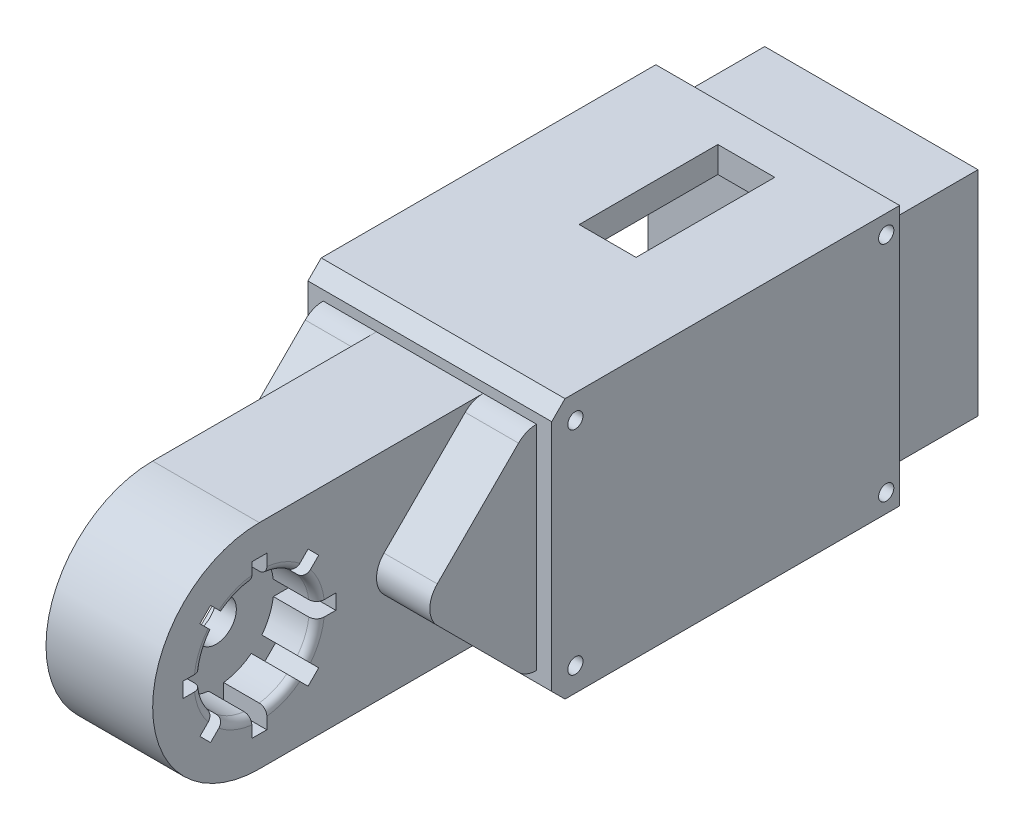
from build123d import *

# Parameters (mm, degrees)
SKETCH2_W                = 42
SKETCH2_H                = 42
BOSS_EXTRUDE1_DEPTH      = 89
SKETCH3_W                = 21
SKETCH3_H                = 42
BOSS_EXTRUDE2_DEPTH      = 42
BOSS_EXTRUDE3_DEPTH      = 21
SKETCH9_R                = 11.35
CUT_EXTRUDE2_DEPTH       = 8.5
CUT_EXTRUDE3_START       = -8.5
SKETCH11_R               = 11.35
CUT_EXTRUDE3_DEPTH       = 8.5
SKETCH12_R               = 3.975
CUT_EXTRUDE4_DEPTH       = 156.157984003
BOSS_EXTRUDE4_DEPTH      = 10.5
BOSS_EXTRUDE4_DEPTH_BACK = 31.5
FILLET1_R                = 5
FILLET2_R                = 5
FILLET3_R                = 5
FILLET4_R                = 5
FILLET5_R                = 5
FILLET6_R                = 5
FILLET7_R                = 1.5
FILLET8_R                = 1.5
SKETCH21_W               = 2.95860585
SKETCH21_H               = 4.417
CUT_EXTRUDE5_DEPTH       = 8.5
CIRPATTERN2_COUNT        = 8
MIRROR1_COPY_1_SKETCH_W  = 2.95860585
MIRROR1_COPY_1_SKETCH_H  = 4.417
MIRROR1_COPY_1_DEPTH     = 8.5
MIRROR1_COPY_2_SKETCH_W  = 2.95860585
MIRROR1_COPY_2_SKETCH_H  = 4.417
MIRROR1_COPY_2_DEPTH     = 8.5
MIRROR1_COPY_3_SKETCH_W  = 2.95860585
MIRROR1_COPY_3_SKETCH_H  = 4.417
MIRROR1_COPY_3_DEPTH     = 8.5
MIRROR1_COPY_4_SKETCH_W  = 2.95860585
MIRROR1_COPY_4_SKETCH_H  = 4.417
MIRROR1_COPY_4_DEPTH     = 8.5
MIRROR1_COPY_5_SKETCH_W  = 2.95860585
MIRROR1_COPY_5_SKETCH_H  = 4.417
MIRROR1_COPY_5_DEPTH     = 8.5
MIRROR1_COPY_6_SKETCH_W  = 2.95860585
MIRROR1_COPY_6_SKETCH_H  = 4.417
MIRROR1_COPY_6_DEPTH     = 8.5
MIRROR1_COPY_7_SKETCH_W  = 2.95860585
MIRROR1_COPY_7_SKETCH_H  = 4.417
MIRROR1_COPY_7_DEPTH     = 8.5
MIRROR1_COPY_8_SKETCH_W  = 2.95860585
MIRROR1_COPY_8_SKETCH_H  = 4.417
MIRROR1_COPY_8_DEPTH     = 8.5
SKETCH24_W               = 86.928932188
SKETCH24_H               = 4.545220174
SKETCH24_H_2             = 4.689106432
BOSS_EXTRUDE6_DEPTH      = 42
SKETCH25_W               = 68.5
SKETCH25_H               = 51.234326606
BOSS_EXTRUDE7_DEPTH      = 3
SKETCH28_W               = 68.5
SKETCH28_H               = 51.234326606
BOSS_EXTRUDE8_DEPTH      = 3
SKETCH30_W               = 62
SKETCH30_H               = 41.004326606
CUT_EXTRUDE6_DEPTH       = 45
SKETCH31_W               = 18.428932188
SKETCH31_H               = 4.615
CUT_EXTRUDE7_DEPTH       = 161.589321529
CHAMFER1_SIZE            = 1.5
SKETCH32_W               = 30
SKETCH32_H               = 30
CUT_EXTRUDE8_DEPTH       = 16.8
SKETCH33_R               = 5
CUT_EXTRUDE9_DEPTH       = 16.8
CUT_EXTRUDE10_DEPTH      = 162.455660134
CHAMFER2_SIZE            = 6
CHAMFER3_SIZE            = 6
CHAMFER4_SIZE            = 6
CHAMFER5_SIZE            = 6
SKETCH35_R               = 1.5
CUT_EXTRUDE11_DEPTH      = 162.455660134
SKETCH38_W               = 11.2
SKETCH38_H               = 27.3
CUT_EXTRUDE12_DEPTH      = 163.188027372


with BuildPart() as part:
    # Sketch2 → Boss-Extrude1 (new body)
    with BuildSketch(Plane.XY):
        Rectangle(SKETCH2_W, SKETCH2_H)
    extrude(amount=BOSS_EXTRUDE1_DEPTH)

    # Sketch3 → Boss-Extrude2 (add)
    with BuildSketch(Plane.XY.offset(89)):
        Rectangle(SKETCH3_W, SKETCH3_H)
    extrude(amount=BOSS_EXTRUDE2_DEPTH)

    # Sketch8 → Boss-Extrude3 (add)
    with BuildSketch(Plane.ZY.offset(10.5)):
        with BuildLine():
            Line((131, 21), (131, -21))
            ThreePointArc((131, -21), (152, 0), (131, 21))
        make_face()
    extrude(amount=-BOSS_EXTRUDE3_DEPTH)

    # Sketch9 → Cut-Extrude2 (cut)
    with BuildSketch(Plane.ZY.offset(10.5)):
        with Locations((131, 0)):
            Circle(SKETCH9_R)
    extrude(amount=-CUT_EXTRUDE2_DEPTH, mode=Mode.SUBTRACT)

    # Sketch11 → Cut-Extrude3 (cut)
    with BuildSketch(Plane(origin=(10.5, 0, 0), x_dir=(0, 0, -1), z_dir=(1, 0, 0)).offset(CUT_EXTRUDE3_START)):
        with Locations((-131, 0)):
            Circle(SKETCH11_R)
    extrude(amount=CUT_EXTRUDE3_DEPTH, mode=Mode.SUBTRACT)

    # Sketch12 → Cut-Extrude4 (cut, through all)
    with BuildSketch(Plane.ZY.offset(2)):
        with Locations((131, 0)):
            Circle(SKETCH12_R)
    extrude(amount=-CUT_EXTRUDE4_DEPTH, mode=Mode.SUBTRACT)

    # Sketch20 → Boss-Extrude4 (add, two sides: drawn at the far end of the back side and taken through both)
    with BuildSketch(Plane.ZY.offset(10.5).offset(-BOSS_EXTRUDE4_DEPTH_BACK)):
        Polygon((89, -21), (110, 0), (89, 21), align=None)
    extrude(amount=BOSS_EXTRUDE4_DEPTH + BOSS_EXTRUDE4_DEPTH_BACK)

    # Fillet1
    fillet1_edges = [part.edges().sort_by_distance(p)[0] for p in [
        (15.75, 0, 110),
    ]]
    fillet(fillet1_edges, radius=FILLET1_R)

    # Fillet2
    fillet2_edges = [part.edges().sort_by_distance(p)[0] for p in [
        (-15.75, 0, 110),
    ]]
    fillet(fillet2_edges, radius=FILLET2_R)

    # Fillet3
    fillet3_edges = [part.edges().sort_by_distance(p)[0] for p in [
        (-15.75, -21, 89),
    ]]
    fillet(fillet3_edges, radius=FILLET3_R)

    # Fillet4
    fillet4_edges = [part.edges().sort_by_distance(p)[0] for p in [
        (-15.75, 21, 89),
    ]]
    fillet(fillet4_edges, radius=FILLET4_R)

    # Fillet5
    fillet5_edges = [part.edges().sort_by_distance(p)[0] for p in [
        (15.75, -21, 89),
    ]]
    fillet(fillet5_edges, radius=FILLET5_R)

    # Fillet6
    fillet6_edges = [part.edges().sort_by_distance(p)[0] for p in [
        (15.75, 21, 89),
    ]]
    fillet(fillet6_edges, radius=FILLET6_R)

    # Fillet7
    fillet7_edges = [part.edges().sort_by_distance(p)[0] for p in [
        (-10.5, 0, 119.65),
    ]]
    fillet(fillet7_edges, radius=FILLET7_R)

    # Fillet8
    fillet8_edges = [part.edges().sort_by_distance(p)[0] for p in [
        (10.5, 0, 142.35),
    ]]
    fillet(fillet8_edges, radius=FILLET8_R)

    # Sketch21 → Cut-Extrude5 (cut)
    with BuildSketch(Plane.ZY.offset(10.5)):
        with Locations((131, 12.85)):
            Rectangle(SKETCH21_W, SKETCH21_H)
    cut_extrude5 = extrude(amount=-CUT_EXTRUDE5_DEPTH, mode=Mode.SUBTRACT)

    # CirPattern2: Cut-Extrude5 ×8 about axis
    cirpattern2_axis = Axis((-9, 0, 131), (-1, 0, 0))
    for i in range(1, CIRPATTERN2_COUNT):
        add(cut_extrude5.rotate(cirpattern2_axis, i * 360 / CIRPATTERN2_COUNT), mode=Mode.SUBTRACT)

    # Mirror1 copy 1 sketch → Mirror1 copy 1 (cut)
    with BuildSketch(Plane(origin=(10.5, -92.630988335, 38.369011665), x_dir=(0, 0.7071067811865475, 0.7071067811865476), z_dir=(1, 0, 0))):
        with Locations((131, -12.85)):
            Rectangle(MIRROR1_COPY_1_SKETCH_W, MIRROR1_COPY_1_SKETCH_H)
    extrude(amount=-MIRROR1_COPY_1_DEPTH, mode=Mode.SUBTRACT)

    # Mirror1 copy 2 sketch → Mirror1 copy 2 (cut)
    with BuildSketch(Plane(origin=(10.5, -131, 131), x_dir=(0, 1, 0), z_dir=(1, 0, 0))):
        with Locations((131, -12.85)):
            Rectangle(MIRROR1_COPY_2_SKETCH_W, MIRROR1_COPY_2_SKETCH_H)
    extrude(amount=-MIRROR1_COPY_2_DEPTH, mode=Mode.SUBTRACT)

    # Mirror1 copy 3 sketch → Mirror1 copy 3 (cut)
    with BuildSketch(Plane(origin=(10.5, -92.630988335, 223.630988335), x_dir=(0, 0.7071067811865476, -0.7071067811865475), z_dir=(1, 0, 0))):
        with Locations((131, -12.85)):
            Rectangle(MIRROR1_COPY_3_SKETCH_W, MIRROR1_COPY_3_SKETCH_H)
    extrude(amount=-MIRROR1_COPY_3_DEPTH, mode=Mode.SUBTRACT)

    # Mirror1 copy 4 sketch → Mirror1 copy 4 (cut)
    with BuildSketch(Plane(origin=(10.5, 0, 262), x_dir=(0, 0, -1), z_dir=(1, 0, 0))):
        with Locations((131, -12.85)):
            Rectangle(MIRROR1_COPY_4_SKETCH_W, MIRROR1_COPY_4_SKETCH_H)
    extrude(amount=-MIRROR1_COPY_4_DEPTH, mode=Mode.SUBTRACT)

    # Mirror1 copy 5 sketch → Mirror1 copy 5 (cut)
    with BuildSketch(Plane(origin=(10.5, 92.630988335, 223.630988335), x_dir=(0, -0.7071067811865475, -0.7071067811865477), z_dir=(1, 0, 0))):
        with Locations((131, -12.85)):
            Rectangle(MIRROR1_COPY_5_SKETCH_W, MIRROR1_COPY_5_SKETCH_H)
    extrude(amount=-MIRROR1_COPY_5_DEPTH, mode=Mode.SUBTRACT)

    # Mirror1 copy 6 sketch → Mirror1 copy 6 (cut)
    with BuildSketch(Plane(origin=(10.5, 131, 131), x_dir=(0, -1, 0), z_dir=(1, 0, 0))):
        with Locations((131, -12.85)):
            Rectangle(MIRROR1_COPY_6_SKETCH_W, MIRROR1_COPY_6_SKETCH_H)
    extrude(amount=-MIRROR1_COPY_6_DEPTH, mode=Mode.SUBTRACT)

    # Mirror1 copy 7 sketch → Mirror1 copy 7 (cut)
    with BuildSketch(Plane(origin=(10.5, 92.630988335, 38.369011665), x_dir=(0, -0.7071067811865477, 0.7071067811865474), z_dir=(1, 0, 0))):
        with Locations((131, -12.85)):
            Rectangle(MIRROR1_COPY_7_SKETCH_W, MIRROR1_COPY_7_SKETCH_H)
    extrude(amount=-MIRROR1_COPY_7_DEPTH, mode=Mode.SUBTRACT)

    # Mirror1 copy 8 sketch → Mirror1 copy 8 (cut)
    with BuildSketch(Plane(origin=(10.5, 0, 0), x_dir=(0, 0, 1), z_dir=(1, 0, 0))):
        with Locations((131, -12.85)):
            Rectangle(MIRROR1_COPY_8_SKETCH_W, MIRROR1_COPY_8_SKETCH_H)
    extrude(amount=-MIRROR1_COPY_8_DEPTH, mode=Mode.SUBTRACT)

    # Sketch24 → Boss-Extrude6 (add)
    with BuildSketch(Plane(origin=(21, 0, 0), x_dir=(0, 0, -1), z_dir=(1, 0, 0))):
        with Locations((-43.464466094, 23.272610087)):
            Rectangle(SKETCH24_W, SKETCH24_H)
        with Locations((-43.464466094, -23.344553216)):
            Rectangle(SKETCH24_W, SKETCH24_H_2)
    extrude(amount=-BOSS_EXTRUDE6_DEPTH)

    # Sketch25 → Boss-Extrude7 (add)
    with BuildSketch(Plane(origin=(21, 0, 0), x_dir=(0, 0, -1), z_dir=(1, 0, 0))):
        with Locations((-52.678932188, -0.071943129)):
            Rectangle(SKETCH25_W, SKETCH25_H)
    extrude(amount=BOSS_EXTRUDE7_DEPTH)

    # Sketch28 → Boss-Extrude8 (add)
    with BuildSketch(Plane.ZY.offset(21)):
        with Locations((52.678932188, -0.071943129)):
            Rectangle(SKETCH28_W, SKETCH28_H)
    extrude(amount=BOSS_EXTRUDE8_DEPTH)

    # Sketch30 → Cut-Extrude6 (cut)
    with BuildSketch(Plane.ZY.offset(24)):
        with Locations((50.928932188, -0.071943129)):
            Rectangle(SKETCH30_W, SKETCH30_H)
    extrude(amount=-CUT_EXTRUDE6_DEPTH, mode=Mode.SUBTRACT)

    # Sketch31 → Cut-Extrude7 (cut, through all)
    with BuildSketch(Plane(origin=(21, 0, 0), x_dir=(0, 0, -1), z_dir=(1, 0, 0))):
        with Locations((-9.214466094, -23.381606432)):
            Rectangle(SKETCH31_W, SKETCH31_H)
        with Locations((-9.214466094, 23.237720174)):
            Rectangle(SKETCH31_W, SKETCH31_H)
    extrude(amount=-CUT_EXTRUDE7_DEPTH, mode=Mode.SUBTRACT)

    # Chamfer1
    chamfer1_edges = [part.edges().sort_by_distance(p)[0] for p in [
        (0, 20.930220174, 18.428932188),
        (21, -0.071943129, 18.428932188),
        (0, -21.074106432, 18.428932188),
        (-21, -0.071943129, 18.428932188),
    ]]
    chamfer(chamfer1_edges, length=CHAMFER1_SIZE)

    # Sketch32 → Cut-Extrude8 (cut)
    with BuildSketch(Plane(origin=(0, 0, 0), x_dir=(-1, 0, 0), z_dir=(0, 0, -1))):
        Rectangle(SKETCH32_W, SKETCH32_H)
    extrude(amount=-CUT_EXTRUDE8_DEPTH, mode=Mode.SUBTRACT)

    # Sketch33 → Cut-Extrude9 (cut)
    with BuildSketch(Plane.XY.offset(19.928932188)):
        Circle(SKETCH33_R)
    extrude(amount=-CUT_EXTRUDE9_DEPTH, mode=Mode.SUBTRACT)

    # Sketch34 → Cut-Extrude10 (cut, through all)
    with BuildSketch(Plane.ZY.offset(24)):
        Polygon((88.330412389, -21.669587611), (88.330412389, -28.222069099), (81.777930901, -28.222069099), align=None)
        Polygon((88.330412389, 28.078182842), (81.777930901, 28.078182842), (88.330412389, 21.525701354), align=None)
    extrude(amount=-CUT_EXTRUDE10_DEPTH, mode=Mode.SUBTRACT)

    # Chamfer2
    chamfer2_edges = [part.edges().sort_by_distance(p)[0] for p in [
        (-1.5, 20.430220174, 81.928932188),
    ]]
    chamfer(chamfer2_edges, length=CHAMFER2_SIZE)

    # Chamfer3
    chamfer3_edges = [part.edges().sort_by_distance(p)[0] for p in [
        (-1.5, -20.574106432, 81.928932188),
    ]]
    chamfer(chamfer3_edges, length=CHAMFER3_SIZE)

    # Chamfer4
    chamfer4_edges = [part.edges().sort_by_distance(p)[0] for p in [
        (-1.5, 20.430220174, 19.928932188),
    ]]
    chamfer(chamfer4_edges, length=CHAMFER4_SIZE)

    # Chamfer5
    chamfer5_edges = [part.edges().sort_by_distance(p)[0] for p in [
        (-1.5, -20.574106432, 19.928932188),
    ]]
    chamfer(chamfer5_edges, length=CHAMFER5_SIZE)

    # Sketch35 → Cut-Extrude11 (cut, through all)
    with BuildSketch(Plane.ZY.offset(24)):
        with Locations((21.074129387, 21.904762541)):
            Circle(SKETCH35_R)
        with Locations((82.274422533, 20.83321052)):
            Circle(SKETCH35_R)
        with Locations((82.274422533, -20.977096777)):
            Circle(SKETCH35_R)
        with Locations((21.073965823, -22.048529957)):
            Circle(SKETCH35_R)
    extrude(amount=-CUT_EXTRUDE11_DEPTH, mode=Mode.SUBTRACT)

    # Sketch38 → Cut-Extrude12 (cut, through all)
    with BuildSketch(Plane(origin=(0, -25.689106432, 0), x_dir=(-1, 0, 0), z_dir=(0, -1, 0))):
        with Locations((-1.30782555, -39.578932188)):
            Rectangle(SKETCH38_W, SKETCH38_H)
    extrude(amount=-CUT_EXTRUDE12_DEPTH, mode=Mode.SUBTRACT)


solid = part.part
